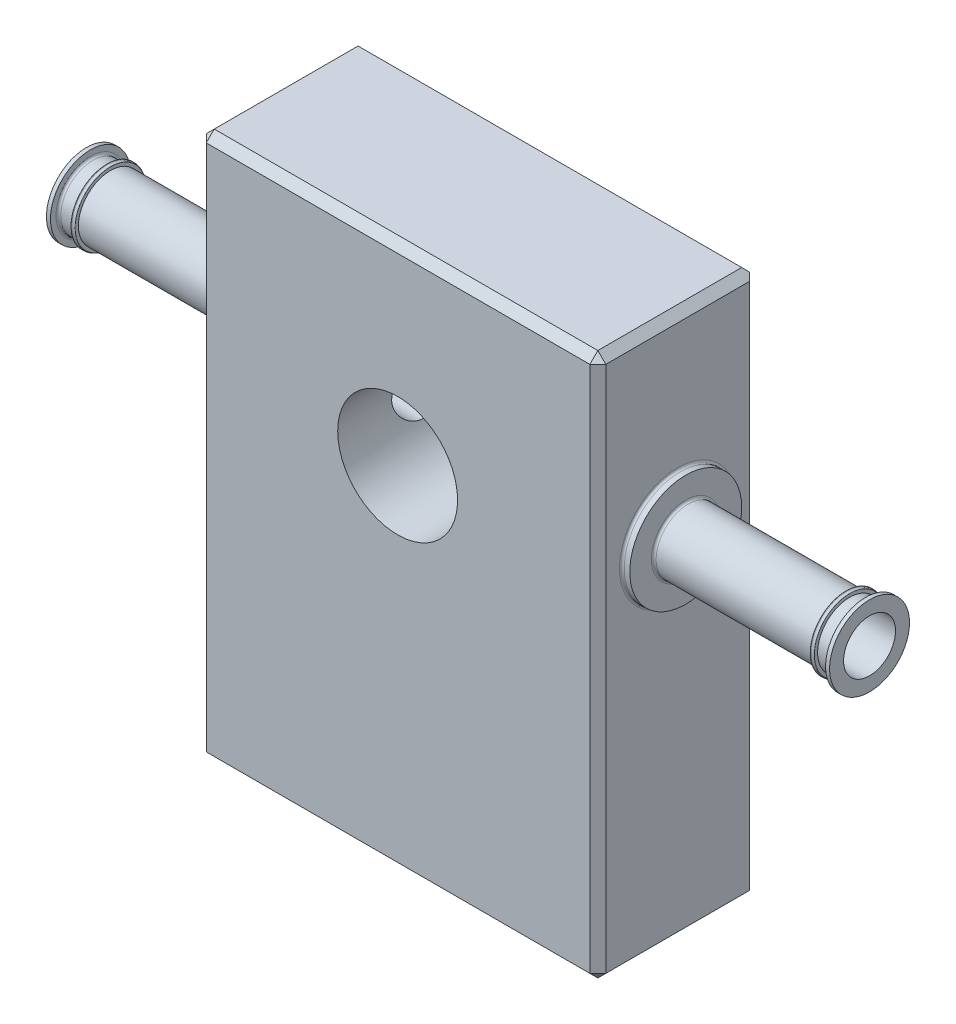
from build123d import *

# Parameters (mm, degrees)
ESTRUSIONE_ESTRUSIONE1_DEPTH  = 4
SCHIZZO2_W                    = 50
SCHIZZO2_H                    = 68
ESTRUSIONE_ESTRUSIONE2_DEPTH  = 16
SCHIZZO3_R                    = 7.5
TAGLIO_ESTRUSIONE1_DEPTH      = 16
SCHIZZO4_R                    = 7
ESTRUSIONE_ESTRUSIONE3_DEPTH  = 1
SCHIZZO5_R                    = 4
ESTRUSIONE_ESTRUSIONE4_DEPTH  = 20
SCHIZZO6_R                    = 4.5
ESTRUSIONE_ESTRUSIONE5_DEPTH  = 0.5
SCHIZZO7_R                    = 4
ESTRUSIONE_ESTRUSIONE6_DEPTH  = 2
SCHIZZO8_R                    = 5
ESTRUSIONE_ESTRUSIONE7_DEPTH  = 0.5
RACCORDO1_R                   = 0.3
RACCORDO2_R                   = 0.3
RACCORDO3_R                   = 0.3
RACCORDO6_SIZE                = 0.1
RACCORDO6_SIZE_2              = 0.3
RACCORDO7_SIZE                = 0.1
RACCORDO7_SIZE_2              = 0.3
TAGLIO_ESTRUSIONE3_REACH      = 93.52
TAGLIO_ESTRUSIONE3_END_RADIUS = 7.5
SCHIZZO9_R                    = 3.25
RACCORDO8_SIZE                = 0.3
RACCORDO8_SIZE_2              = 0.1
RACCORDO9_SIZE                = 0.3
RACCORDO9_SIZE_2              = 0.1
RACCORDO12_R                  = 0.3
RACCORDO13_R                  = 0.3
SMUSSO1_SIZE                  = 1
SMUSSO2_SIZE                  = 1
FORO_PER_VITE_M1_1_D          = 5
FORO_PER_VITE_M1_1_DEPTH      = 15
RIPETIZIONECIRCOLARE4_COUNT   = 4


with BuildPart() as part:
    # Schizzo1 → Estrusione-Estrusione1 (new body)
    with BuildSketch(Plane.XY):
        Polygon((25, 50), (-25, 50), (-25, -18), (-16.05, -18), (-16.05, 42), (16.05, 42), (16.05, -18), (25, -18), align=None)
    extrude(amount=ESTRUSIONE_ESTRUSIONE1_DEPTH)

    # Schizzo2 → Estrusione-Estrusione2 (add)
    with BuildSketch(Plane.XY.offset(4)):
        with Locations((0, 16)):
            Rectangle(SCHIZZO2_W, SCHIZZO2_H)
    extrude(amount=ESTRUSIONE_ESTRUSIONE2_DEPTH)

    # Schizzo3 → Taglio-Estrusione1 (cut)
    with BuildSketch(Plane(origin=(0, 0, 4), x_dir=(-1, 0, 0), z_dir=(0, 0, -1))):
        with Locations((0.05, 26)):
            Circle(SCHIZZO3_R)
    extrude(amount=-TAGLIO_ESTRUSIONE1_DEPTH, mode=Mode.SUBTRACT)

    # Schizzo4 → Estrusione-Estrusione3 (add)
    with BuildSketch(Plane(origin=(25, 0, 0), x_dir=(0, 0, -1), z_dir=(1, 0, 0))):
        with Locations((-10, 26)):
            Circle(SCHIZZO4_R)
    estrusione_estrusione3 = extrude(amount=ESTRUSIONE_ESTRUSIONE3_DEPTH)

    # Schizzo5 → Estrusione-Estrusione4 (add)
    with BuildSketch(Plane(origin=(26, 0, 0), x_dir=(0, 0, -1), z_dir=(1, 0, 0))):
        with Locations((-10, 26)):
            Circle(SCHIZZO5_R)
    estrusione_estrusione4 = extrude(amount=ESTRUSIONE_ESTRUSIONE4_DEPTH)

    # Schizzo6 → Estrusione-Estrusione5 (add)
    with BuildSketch(Plane(origin=(46, 0, 0), x_dir=(0, 0, -1), z_dir=(1, 0, 0))):
        with Locations((-10, 26)):
            Circle(SCHIZZO6_R)
    estrusione_estrusione5 = extrude(amount=ESTRUSIONE_ESTRUSIONE5_DEPTH)

    # Schizzo7 → Estrusione-Estrusione6 (add)
    with BuildSketch(Plane(origin=(46.5, 0, 0), x_dir=(0, 0, -1), z_dir=(1, 0, 0))):
        with Locations((-10, 26)):
            Circle(SCHIZZO7_R)
    estrusione_estrusione6 = extrude(amount=ESTRUSIONE_ESTRUSIONE6_DEPTH)

    # Schizzo8 → Estrusione-Estrusione7 (add)
    with BuildSketch(Plane(origin=(48.5, 0, 0), x_dir=(0, 0, -1), z_dir=(1, 0, 0))):
        with Locations((-10, 26)):
            Circle(SCHIZZO8_R)
    estrusione_estrusione7 = extrude(amount=ESTRUSIONE_ESTRUSIONE7_DEPTH)

    # Raccordo1
    raccordo1_edges = [part.edges().sort_by_distance(p)[0] for p in [
        (25, 26, 17),
    ]]
    fillet(raccordo1_edges, radius=RACCORDO1_R)

    # Raccordo2
    raccordo2_edges = [part.edges().sort_by_distance(p)[0] for p in [
        (26, 26, 14),
    ]]
    fillet(raccordo2_edges, radius=RACCORDO2_R)

    # Raccordo3
    raccordo3_edges = [part.edges().sort_by_distance(p)[0] for p in [
        (48.5, 26, 14),
    ]]
    fillet(raccordo3_edges, radius=RACCORDO3_R)

    # Raccordo6
    # an asymmetric fillet: 0.3, 0.1 mm, written as the material it takes off along each edge
    with BuildSketch(Plane(origin=(46, 26, 10), x_dir=(0, 0, -1), z_dir=(0, -1, 0))) as raccordo6_piece_1:
        with BuildLine():
            Bezier((4.5, RACCORDO6_SIZE), (4.5, 0), (4.5 - RACCORDO6_SIZE_2, 0), weights=[1, 0.707106781, 1])
            Line((4.5 - RACCORDO6_SIZE_2, 0), (4.5, 0))
            Line((4.5, 0), (4.5, RACCORDO6_SIZE))
        make_face()
    revolve(axis=Axis((46, 26, 10), (1, 0, 0)), mode=Mode.SUBTRACT)

    # Raccordo7
    # an asymmetric fillet: 0.3, 0.1 mm, written as the material it takes off along each edge
    with BuildSketch(Plane(origin=(46.5, 26, 10), x_dir=(0, 0, -1), z_dir=(0, -1, 0))) as raccordo7_piece_1:
        with BuildLine():
            Bezier((4.5 - RACCORDO7_SIZE, 0), (4.5, 0), (4.5, -RACCORDO7_SIZE_2), weights=[1, 0.707106781, 1])
            Line((4.5, -RACCORDO7_SIZE_2), (4.5, 0))
            Line((4.5, 0), (4.5 - RACCORDO7_SIZE, 0))
        make_face()
    revolve(axis=Axis((46.5, 26, 10), (1, 0, 0)), mode=Mode.SUBTRACT)

    # Taglio-Estrusione3: up to this cylinder (the profile starts outside it)
    taglio_estrusione3_end = Plane(origin=(-0.05, 26, 10), z_dir=(0, 0, -1)) * Cylinder(TAGLIO_ESTRUSIONE3_END_RADIUS, 203.04, mode=Mode.PRIVATE)
    # Schizzo9 → Taglio-Estrusione3 (cut, up to the surface)
    with BuildSketch(Plane(origin=(49, 0, 0), x_dir=(0, 0, -1), z_dir=(1, 0, 0)), mode=Mode.PRIVATE) as taglio_estrusione3_sk1:
        with Locations((-10, 26)):
            Circle(SCHIZZO9_R)
    taglio_estrusione3_tool1 = extrude(taglio_estrusione3_sk1.sketch, amount=-TAGLIO_ESTRUSIONE3_REACH, mode=Mode.PRIVATE) - taglio_estrusione3_end
    taglio_estrusione3 = taglio_estrusione3_tool1.solids().sort_by_distance((49, 26, 10))[0]
    add(taglio_estrusione3, mode=Mode.SUBTRACT)

    # Specchia4: Estrusione-Estrusione3, Estrusione-Estrusione4, Estrusione-Estrusione5, Estrusione-Estrusione6, Estrusione-Estrusione7 across plane
    add(estrusione_estrusione3.mirror(Plane(origin=(0, 0, 0), x_dir=(0, 0, 1), z_dir=(1, 0, 0))))
    add(estrusione_estrusione4.mirror(Plane(origin=(0, 0, 0), x_dir=(0, 0, 1), z_dir=(1, 0, 0))))
    add(estrusione_estrusione5.mirror(Plane(origin=(0, 0, 0), x_dir=(0, 0, 1), z_dir=(1, 0, 0))))
    add(estrusione_estrusione6.mirror(Plane(origin=(0, 0, 0), x_dir=(0, 0, 1), z_dir=(1, 0, 0))))
    add(estrusione_estrusione7.mirror(Plane(origin=(0, 0, 0), x_dir=(0, 0, 1), z_dir=(1, 0, 0))))

    # Raccordo8
    # an asymmetric fillet: 0.3, 0.1 mm, written as the material it takes off along each edge
    with BuildSketch(Plane(origin=(-46, 26, 10), x_dir=(0, 0, -1), z_dir=(0, -1, 0))) as raccordo8_piece_1:
        with BuildLine():
            Bezier((4.5, -RACCORDO8_SIZE), (4.5, 0), (4.5 - RACCORDO8_SIZE_2, 0), weights=[1, 0.707106781, 1])
            Line((4.5 - RACCORDO8_SIZE_2, 0), (4.5, 0))
            Line((4.5, 0), (4.5, -RACCORDO8_SIZE))
        make_face()
    revolve(axis=Axis((-46, 26, 10), (1, 0, 0)), mode=Mode.SUBTRACT)

    # Raccordo9
    # an asymmetric fillet: 0.3, 0.1 mm, written as the material it takes off along each edge
    with BuildSketch(Plane(origin=(-46.5, 26, 10), x_dir=(0, 0, -1), z_dir=(0, -1, 0))) as raccordo9_piece_1:
        with BuildLine():
            Bezier((4.5 - RACCORDO9_SIZE, 0), (4.5, 0), (4.5, RACCORDO9_SIZE_2), weights=[1, 0.707106781, 1])
            Line((4.5, RACCORDO9_SIZE_2), (4.5, 0))
            Line((4.5, 0), (4.5 - RACCORDO9_SIZE, 0))
        make_face()
    revolve(axis=Axis((-46.5, 26, 10), (1, 0, 0)), mode=Mode.SUBTRACT)

    # Raccordo12
    raccordo12_edges = [part.edges().sort_by_distance(p)[0] for p in [
        (-25, 26, 17),
        (-26, 26, 14),
    ]]
    fillet(raccordo12_edges, radius=RACCORDO12_R)

    # Raccordo13
    raccordo13_edges = [part.edges().sort_by_distance(p)[0] for p in [
        (-48.5, 26, 14),
    ]]
    fillet(raccordo13_edges, radius=RACCORDO13_R)

    # Specchia9: Taglio-Estrusione3 across plane
    add(taglio_estrusione3.mirror(Plane(origin=(0, 0, 0), x_dir=(0, 0, 1), z_dir=(1, 0, 0))), mode=Mode.SUBTRACT)

    # Smusso1
    smusso1_edges = [part.edges().sort_by_distance(p)[0] for p in [
        (-20.525, -18, 0),
        (-25, 16, 0),
        (0, 50, 0),
        (25, 16, 0),
        (20.525, -18, 0),
    ]]
    chamfer(smusso1_edges, length=SMUSSO1_SIZE)

    # Smusso2
    smusso2_edges = [part.edges().sort_by_distance(p)[0] for p in [
        (-25, -18, 10.5),
        (-25, 50, 10.5),
        (25, 50, 10.5),
        (25, -18, 10.5),
        (-25, 16, 20),
        (0, -18, 20),
        (25, 16, 20),
        (0, 50, 20),
    ]]
    chamfer(smusso2_edges, length=SMUSSO2_SIZE)

    # Foro per Vite M1-1
    with Locations(Plane(origin=(0, 0, 0), x_dir=(-1, 0, 0), z_dir=(0, 0, -1))):
        with Locations((-19.747979695, 45.8)):
            foro_per_vite_m1_1 = Hole(FORO_PER_VITE_M1_1_D / 2, depth=FORO_PER_VITE_M1_1_DEPTH)

    # RipetizioneCircolare4: Foro per Vite M1-1 ×4 about axis
    ripetizionecircolare4_axis = Axis((-0.05, 26, 0), (0, 0, 1))
    for i in range(1, RIPETIZIONECIRCOLARE4_COUNT):
        add(foro_per_vite_m1_1.rotate(ripetizionecircolare4_axis, i * 360 / RIPETIZIONECIRCOLARE4_COUNT), mode=Mode.SUBTRACT)


solid = part.part
